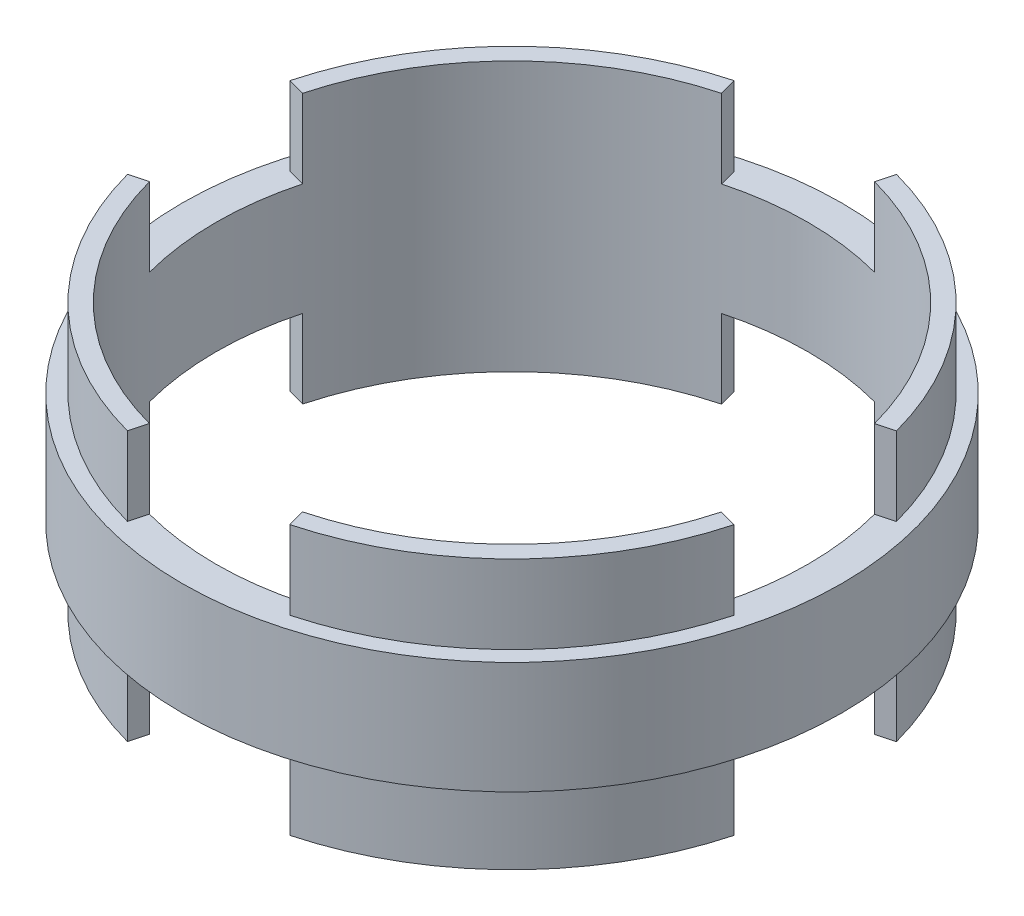
from build123d import *
from build123d.topology import SkipClean

# Parameters (mm, degrees)
SKETCH1_R           = 93.345
SKETCH1_R_2         = 83.82
BOSS_EXTRUDE1_DEPTH = 15.875
SKETCH2_R           = 88.9
SKETCH2_R_2         = 83.82
BOSS_EXTRUDE2_DEPTH = 38.1
CUT_EXTRUDE1_DEPTH  = 38.1
CIRPATTERN1_COUNT   = 4
SKETCH4_R           = 88.9
SKETCH4_R_2         = 83.82
BOSS_EXTRUDE3_DEPTH = 15.875


with BuildPart() as part:
    # Sketch1 → Boss-Extrude1 (new, symmetric)
    with BuildSketch(Plane(origin=(0, 0, 0), x_dir=(1, 0, 0), z_dir=(0, 1, 0))):
        Circle(SKETCH1_R)
        Circle(SKETCH1_R_2, mode=Mode.SUBTRACT)
    extrude(amount=BOSS_EXTRUDE1_DEPTH, both=True)

    # Sketch2 → Boss-Extrude2 (add, symmetric)
    with BuildSketch(Plane(origin=(0, 0, 0), x_dir=(1, 0, 0), z_dir=(0, 1, 0))):
        Circle(SKETCH2_R)
        Circle(SKETCH2_R_2, mode=Mode.SUBTRACT)
    extrude(amount=BOSS_EXTRUDE2_DEPTH, both=True)

    # Sketch3 → Cut-Extrude1 (cut, symmetric)
    with BuildSketch(Plane(origin=(0, 0, 0), x_dir=(1, 0, 0), z_dir=(0, 1, 0))):
        with BuildLine():
            Line((0, 0), (-22.96498538, 85.882591056))
            ThreePointArc((-22.96498538, 85.882591056), (0.022788865, 88.899997079), (23.00901311, 85.870805957))
            Line((23.00901311, 85.870805957), (0, 0))
        make_face()
    cut_extrude1 = extrude(amount=CUT_EXTRUDE1_DEPTH, both=True, mode=Mode.SUBTRACT)

    # CirPattern1: Cut-Extrude1 ×4 about axis
    cirpattern1_axis = Axis((0, 38.1, 0), (0, -1, 0))
    for i in range(1, CIRPATTERN1_COUNT):
        add(cut_extrude1.rotate(cirpattern1_axis, i * 360 / CIRPATTERN1_COUNT), mode=Mode.SUBTRACT)

    # Sketch4 → Boss-Extrude3 (add, symmetric)
    with SkipClean():  # the faces are left unmerged after this step: merging them gives an invalid solid
        with BuildSketch(Plane(origin=(0, 0, 0), x_dir=(1, 0, 0), z_dir=(0, 1, 0))):
            Circle(SKETCH4_R)
            Circle(SKETCH4_R_2, mode=Mode.SUBTRACT)
        extrude(amount=BOSS_EXTRUDE3_DEPTH, both=True)


solid = part.part
